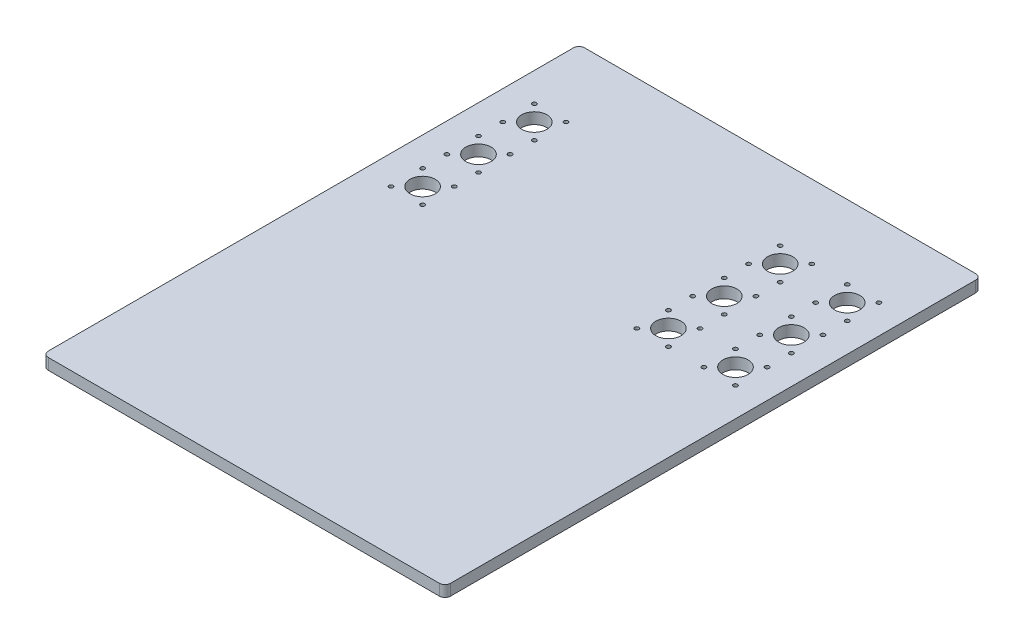
from build123d import *

# Parameters (mm, degrees)
SKETCH2_W           = 457.2
SKETCH2_H           = 609.6
BOSS_EXTRUDE1_DEPTH = 12.7
SKETCH3_R           = 14.3383
SKETCH3_R_2         = 2.38125
CUT_EXTRUDE1_DEPTH  = 382.211607903
FILLET1_R           = 6.35


with BuildPart() as part:
    # Sketch2 → Boss-Extrude1 (new body)
    with BuildSketch(Plane(origin=(0, 0, 0), x_dir=(1, 0, 0), z_dir=(0, 1, 0))):
        Rectangle(SKETCH2_W, SKETCH2_H)
    extrude(amount=BOSS_EXTRUDE1_DEPTH)

    # Sketch3 → Cut-Extrude1 (cut, through all)
    with BuildSketch(Plane(origin=(0, 12.7, 0), x_dir=(1, 0, 0), z_dir=(0, 1, 0))):
        with Locations((-177.8, 203.2)):
            Circle(SKETCH3_R)
        with Locations((-195.760512242, 221.160512242)):
            Circle(SKETCH3_R_2)
        with Locations((-159.839487758, 221.160512242)):
            Circle(SKETCH3_R_2)
        with Locations((-159.839487758, 185.239487758)):
            Circle(SKETCH3_R_2)
        with Locations((-195.760512242, 185.239487758)):
            Circle(SKETCH3_R_2)
        with Locations((195.760512242, 185.239487758)):
            Circle(SKETCH3_R_2)
        with Locations((159.839487758, 185.239487758)):
            Circle(SKETCH3_R_2)
        with Locations((159.839487758, 221.160512242)):
            Circle(SKETCH3_R_2)
        with Locations((195.760512242, 221.160512242)):
            Circle(SKETCH3_R_2)
        with Locations((177.8, 203.2)):
            Circle(SKETCH3_R)
        with Locations((177.8, 139.7)):
            Circle(SKETCH3_R)
        with Locations((195.760512242, 121.739487758)):
            Circle(SKETCH3_R_2)
        with Locations((159.839487758, 121.739487758)):
            Circle(SKETCH3_R_2)
        with Locations((159.839487758, 157.660512242)):
            Circle(SKETCH3_R_2)
        with Locations((195.760512242, 157.660512242)):
            Circle(SKETCH3_R_2)
        with Locations((-195.760512242, 157.660512242)):
            Circle(SKETCH3_R_2)
        with Locations((-159.839487758, 157.660512242)):
            Circle(SKETCH3_R_2)
        with Locations((-159.839487758, 121.739487758)):
            Circle(SKETCH3_R_2)
        with Locations((-195.760512242, 121.739487758)):
            Circle(SKETCH3_R_2)
        with Locations((-177.8, 139.7)):
            Circle(SKETCH3_R)
        with Locations((177.8, 76.2)):
            Circle(SKETCH3_R)
        with Locations((195.760512242, 58.239487758)):
            Circle(SKETCH3_R_2)
        with Locations((159.839487758, 58.239487758)):
            Circle(SKETCH3_R_2)
        with Locations((159.839487758, 94.160512242)):
            Circle(SKETCH3_R_2)
        with Locations((195.760512242, 94.160512242)):
            Circle(SKETCH3_R_2)
        with Locations((-195.760512242, 94.160512242)):
            Circle(SKETCH3_R_2)
        with Locations((-159.839487758, 94.160512242)):
            Circle(SKETCH3_R_2)
        with Locations((-159.839487758, 58.239487758)):
            Circle(SKETCH3_R_2)
        with Locations((-195.760512242, 58.239487758)):
            Circle(SKETCH3_R_2)
        with Locations((-177.8, 76.2)):
            Circle(SKETCH3_R)
        with Locations((101.6, 76.2)):
            Circle(SKETCH3_R)
        with Locations((119.560512242, 58.239487758)):
            Circle(SKETCH3_R_2)
        with Locations((83.639487758, 58.239487758)):
            Circle(SKETCH3_R_2)
        with Locations((83.639487758, 94.160512242)):
            Circle(SKETCH3_R_2)
        with Locations((119.560512242, 94.160512242)):
            Circle(SKETCH3_R_2)
        with Locations((101.6, 139.7)):
            Circle(SKETCH3_R)
        with Locations((119.560512242, 121.739487758)):
            Circle(SKETCH3_R_2)
        with Locations((83.639487758, 121.739487758)):
            Circle(SKETCH3_R_2)
        with Locations((83.639487758, 157.660512242)):
            Circle(SKETCH3_R_2)
        with Locations((119.560512242, 157.660512242)):
            Circle(SKETCH3_R_2)
        with Locations((119.560512242, 185.239487758)):
            Circle(SKETCH3_R_2)
        with Locations((83.639487758, 185.239487758)):
            Circle(SKETCH3_R_2)
        with Locations((83.639487758, 221.160512242)):
            Circle(SKETCH3_R_2)
        with Locations((119.560512242, 221.160512242)):
            Circle(SKETCH3_R_2)
        with Locations((101.6, 203.2)):
            Circle(SKETCH3_R)
    extrude(amount=-CUT_EXTRUDE1_DEPTH, mode=Mode.SUBTRACT)

    # Fillet1
    fillet1_edges = [part.edges().sort_by_distance(p)[0] for p in [
        (-228.6, 6.35, 304.8),
        (228.6, 6.35, 304.8),
        (-228.6, 6.35, -304.8),
        (228.6, 6.35, -304.8),
    ]]
    fillet(fillet1_edges, radius=FILLET1_R)


solid = part.part
